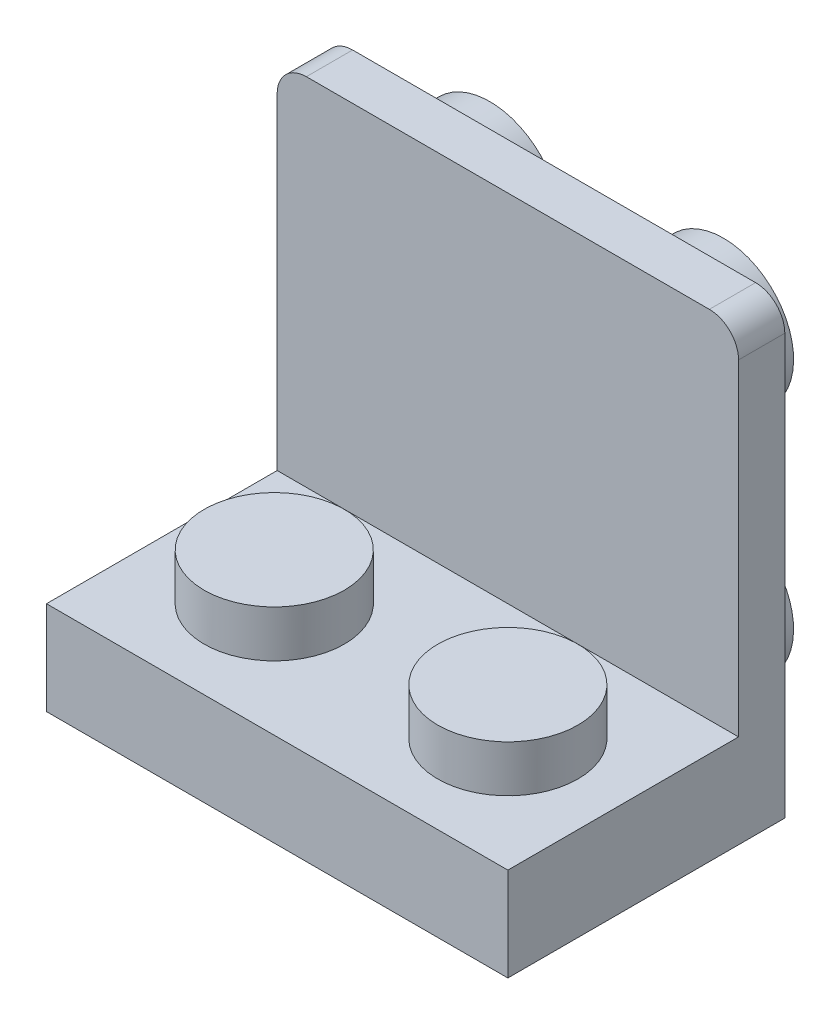
from build123d import *

# Parameters (mm, degrees)
MAINBASESKETCH_W                       = 15.8
MAINBASESKETCH_H                       = 3.2
MAINBASEEXTRUDE_DEPTH                  = 7.9
STUDSSKETCH_R                          = 2.4
STUDSEXTRUDE_DEPTH                     = 1.6
STUDSPATTERN_COUNT                     = 2
STUDSPATTERN_PITCH                     = 8
STUDSPATTERN_COUNT_DIR2                = 2
STUDSPATTERN_PITCH_DIR2                = 8
MAINBASESHELL_T                        = -1.2
LCUTBLUE_DEPTH                         = 19.555463972
LCUTBLUE_DEPTH_BACK                    = 19.555463972
CUTADDEDTOLCUT_DEPTH                   = 2
MADESLIMCUTSKETCH_W                    = 7.9
MADESLIMCUTSKETCH_H                    = 7.9
MADESLIMCUT_DEPTH                      = 19.897228453
MADESLIMFILLEXT_REACH                  = 20.897
SKETCH33_W                             = 5.500952983
SKETCH33_H                             = 1.199047018
SLIMHOLEEXT_START                      = -0.2
SLIMHOLESKETCH_R                       = 1.75
SLIMHOLESKETCH_R_2                     = 0.75
SLIMHOLEEXT_DEPTH                      = 2
SHORTLEXTENSIONSKETCH_W                = 1.583745828
SHORTLEXTENSIONSKETCH_H                = 7.9
SHORTLEXTENDEDCUTSKETCH_W              = 13.4
SHORTLEXTENDEDCUTSKETCH_H              = 1.582792846
SHORTLEXTENDEDCUT_DEPTH                = 2
SHORTLUNDERSTUMPS_START                = -0.2
SHORTLUNDERSTUMPSKETCH_W               = 0.996828098
SHORTLUNDERSTUMPSKETCH_H               = 1.1
SHORTLUNDERSTUMPS_DEPTH                = 1.5
SHORTLUPPERCIRCLES_START               = -0.2
SHORTLUPPERCIRCLESSKETCH_R             = 2.4
SHORTLUPPERCIRCLESSKETCH_R_2           = 2
SHORTLUPPERCIRCLESSKETCH_R_3           = 2.45
SHORTLUPPERCIRCLES_DEPTH               = 2
TALLERLBASEEXTENSIONSKETCH_W           = 1.583745828
TALLERLBASEEXTENSIONSKETCH_H           = 7.48
F_4UPPERCIRCLESTALLERLBASE_START       = -3.383745828
F_4UPPERCIRCLESTALLERLBASE_OUTLINE_R   = 2.45
F_4UPPERCIRCLESTALLERLBASE_OUTLINE_R_2 = 2
F_4UPPERCIRCLESTALLERLBASE_OUTLINE_R_3 = 2.4
F_4UPPERCIRCLESTALLERLBASE_DEPTH       = 1.8
TALLERLBASEOUTERCHAMFER_R              = 1


# Read off the part's stored shape, not the designer's step: 4UpperCirclesTallerLBase
with BuildPart() as part:
    # MainBaseSketch → MainBaseExtrude (new, symmetric)
    with BuildSketch(Plane.XY):
        with Locations((8.581967213, 1.6)):
            Rectangle(MAINBASESKETCH_W, MAINBASESKETCH_H)
    extrude(amount=MAINBASEEXTRUDE_DEPTH, both=True)

    # StudsSketch → StudsExtrude (add)
    with BuildSketch(Plane(origin=(0, 3.2, 0), x_dir=(1, 0, 0), z_dir=(0, 1, 0))):
        with Locations((4.581967213, 4)):
            Circle(STUDSSKETCH_R)
    studsextrude = extrude(amount=STUDSEXTRUDE_DEPTH)

    # StudsPattern: StudsExtrude 2 × 2
    with Locations(*[(j * STUDSPATTERN_PITCH_DIR2, 0, i * STUDSPATTERN_PITCH) for i in range(STUDSPATTERN_COUNT) for j in range(STUDSPATTERN_COUNT_DIR2) if (i, j) != (0, 0)]):
        add(studsextrude)

    # MainBaseShell
    mainbaseshell_openings = [part.faces().sort_by_distance(p)[0] for p in [
        (8.581967213, 0, 0),
    ]]
    offset(amount=MAINBASESHELL_T, openings=mainbaseshell_openings, kind=Kind.INTERSECTION)

    # LCUTBlueSketch → LCutBlue (cut, two sides: drawn at the far end of the back side and taken through both)
    with BuildSketch(Plane(origin=(0, 3.2, 0), x_dir=(1, 0, 0), z_dir=(0, 1, 0)).offset(-LCUTBLUE_DEPTH_BACK)):
        Polygon((8.581967213, 53.229874044), (8.581967213, 7.9), (8.581967213, 0), (16.481967213, 0), (61.811841258, 0), (125.917963912, 64.106122654), (72.688089868, 117.335996699), align=None)
    extrude(amount=LCUTBLUE_DEPTH + LCUTBLUE_DEPTH_BACK, mode=Mode.SUBTRACT)

    # CutAddedtoLSketch → CutAddedToLCut (add)
    with BuildSketch(Plane.XZ):
        Polygon((7.382920196, -6.7), (8.581967213, -6.7), (8.581967213, 0), (15.281967213, 0), (15.281967213, 1.199047018), (7.382920196, 1.199047018), (7.382920196, 0), align=None)
    extrude(amount=-CUTADDEDTOLCUT_DEPTH)

    # MadeSlimCutSketch → MadeSlimCut (cut, through all)
    with BuildSketch(Plane.XZ):
        with Locations((4.631967213, -3.95)):
            Rectangle(MADESLIMCUTSKETCH_W, MADESLIMCUTSKETCH_H)
    extrude(amount=-MADESLIMCUT_DEPTH, mode=Mode.SUBTRACT)

    # Sketch33 → MadeSlimFillExt (add, up to next)
    with BuildSketch(Plane.XZ, mode=Mode.PRIVATE) as madeslimfillext_sk1:
        with Locations((4.632443704, 0.599523509)):
            Rectangle(SKETCH33_W, SKETCH33_H)
    madeslimfillext_tool1 = extrude(madeslimfillext_sk1.sketch, amount=-MADESLIMFILLEXT_REACH, mode=Mode.PRIVATE) - part.part
    add(madeslimfillext_tool1.solids().sort_by_distance((4.632444, 0, 0.599524))[0])

    # SlimHoleSketch → SlimHoleExt (add)
    with BuildSketch(Plane.XZ.offset(-2).offset(SLIMHOLEEXT_START)):
        with Locations((8.581967213, 4)):
            Circle(SLIMHOLESKETCH_R)
        with Locations((8.581967213, 4)):
            Circle(SLIMHOLESKETCH_R_2, mode=Mode.SUBTRACT)
    extrude(amount=SLIMHOLEEXT_DEPTH)

    # ShortLExtension: sweep along a curve in space
    with BuildLine() as shortlextension_path:
        Line((0.681967213, 3.2, 0), (16.481967213, 3.2, 0))
    # ShortLExtensionSketch → ShortLExtension (sweep)
    with BuildSketch(Plane(origin=(16.481967213, 0, 0), x_dir=(0, 0, -1), z_dir=(1, 0, 0))):
        with Locations((0.791872914, 3.95)):
            Rectangle(SHORTLEXTENSIONSKETCH_W, SHORTLEXTENSIONSKETCH_H)
    sweep(path=shortlextension_path.line)

    # ShortLExtendedCutSketch → ShortLExtendedCut (cut)
    with BuildSketch(Plane.XZ):
        with Locations((8.581967213, 0.407650595)):
            Rectangle(SHORTLEXTENDEDCUTSKETCH_W, SHORTLEXTENDEDCUTSKETCH_H)
    extrude(amount=-SHORTLEXTENDEDCUT_DEPTH, mode=Mode.SUBTRACT)

    # ShortLUnderStumpSketch → ShortLUnderStumps (add)
    with BuildSketch(Plane.XZ.offset(-2).offset(SHORTLUNDERSTUMPS_START)):
        with Locations((4.581764801, 0.166254172)):
            Rectangle(SHORTLUNDERSTUMPSKETCH_W, SHORTLUNDERSTUMPSKETCH_H)
        with Locations((8.57767054, 0.166254172)):
            Rectangle(SHORTLUNDERSTUMPSKETCH_W, SHORTLUNDERSTUMPSKETCH_H)
        with Locations((12.582169625, 0.166254172)):
            Rectangle(SHORTLUNDERSTUMPSKETCH_W, SHORTLUNDERSTUMPSKETCH_H)
    extrude(amount=SHORTLUNDERSTUMPS_DEPTH)

    # ShortLUpperCirclesSketch → ShortLUpperCircles (add)
    # profile 1 of 2: a face of its own
    with BuildSketch(Plane(origin=(0, 0, -1.583745828), x_dir=(-1, 0, 0), z_dir=(0, 0, -1)).offset(SHORTLUPPERCIRCLES_START)):
        with Locations(Location((-12.581967213, 3.95, 0), (0, 0, 90))):
            Circle(SHORTLUPPERCIRCLESSKETCH_R)
        with Locations(Location((-12.581967213, 3.95, 0), (0, 0, 90))):
            Circle(SHORTLUPPERCIRCLESSKETCH_R_2, mode=Mode.SUBTRACT)
    # profile 2 of 2: a face of its own
    with BuildSketch(Plane(origin=(0, 0, -1.583745828), x_dir=(-1, 0, 0), z_dir=(0, 0, -1)).offset(SHORTLUPPERCIRCLES_START)):
        with Locations(Location((-4.581967213, 3.95, 0), (0, 0, 270))):
            Circle(SHORTLUPPERCIRCLESSKETCH_R_3)
        with Locations(Location((-4.581967213, 3.95, 0), (0, 0, 270))):
            Circle(SHORTLUPPERCIRCLESSKETCH_R_2, mode=Mode.SUBTRACT)
    extrude(amount=SHORTLUPPERCIRCLES_DEPTH)

    # TallerLBaseExtension: sweep along a curve in space
    with BuildLine() as tallerlbaseextension_path:
        Line((0.681967213, 7.9, -1.583745828), (16.481967213, 7.9, -1.583745828))
    # TallerLBaseExtensionSketch → TallerLBaseExtension (sweep)
    with BuildSketch(Plane(origin=(16.481967213, 0, 0), x_dir=(0, 0, -1), z_dir=(1, 0, 0))):
        with Locations((0.791872914, 11.64)):
            Rectangle(TALLERLBASEEXTENSIONSKETCH_W, TALLERLBASEEXTENSIONSKETCH_H)
    sweep(path=tallerlbaseextension_path.line)

    # 4UpperCirclesTallerLBase outline → 4UpperCirclesTallerLBase (add)
    # profile 1 of 2: a face of its own
    with BuildSketch(Plane.XY.offset(F_4UPPERCIRCLESTALLERLBASE_START)):
        with Locations((4.581967213, 11.95)):
            Circle(F_4UPPERCIRCLESTALLERLBASE_OUTLINE_R)
        with Locations((4.581967213, 11.95)):
            Circle(F_4UPPERCIRCLESTALLERLBASE_OUTLINE_R_2, mode=Mode.SUBTRACT)
    # profile 2 of 2: a face of its own
    with BuildSketch(Plane.XY.offset(F_4UPPERCIRCLESTALLERLBASE_START)):
        with Locations((12.581967213, 11.95)):
            Circle(F_4UPPERCIRCLESTALLERLBASE_OUTLINE_R_3)
        with Locations((12.581967213, 11.95)):
            Circle(F_4UPPERCIRCLESTALLERLBASE_OUTLINE_R_2, mode=Mode.SUBTRACT)
    extrude(amount=F_4UPPERCIRCLESTALLERLBASE_DEPTH)

    # TallerLBaseOuterChamfer
    tallerlbaseouterchamfer_edges = [part.edges().sort_by_distance(p)[0] for p in [
        (16.481967213, 15.38, -0.791872914),
        (0.681967213, 15.38, -0.791872914),
    ]]
    fillet(tallerlbaseouterchamfer_edges, radius=TALLERLBASEOUTERCHAMFER_R)


solid = part.part
